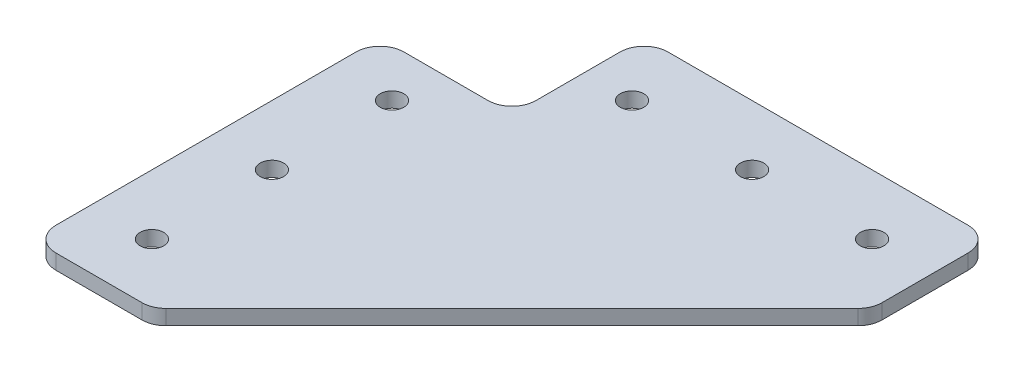
from build123d import *

# Parameters (mm, degrees)
BOSS_EXTRUDE1_DEPTH = 3.175
SKETCH2_R           = 2.4892
CUT_EXTRUDE1_DEPTH  = 144.719172782
SKETCH3_W           = 27.94
SKETCH3_H           = 27.94
CUT_EXTRUDE2_DEPTH  = 144.719172782
FILLET1_R           = 5.08


with BuildPart() as part:
    # Sketch1 → Boss-Extrude1 (new body)
    with BuildSketch(Plane(origin=(0, 0, 0), x_dir=(1, 0, 0), z_dir=(0, 1, 0))):
        Polygon((0, 0), (0, 101.6), (101.6, 101.6), (101.6, 76.2), (25.4, 0), align=None)
    extrude(amount=BOSS_EXTRUDE1_DEPTH)

    # Sketch2 → Cut-Extrude1 (cut, through all)
    with BuildSketch(Plane(origin=(0, 3.175, 0), x_dir=(1, 0, 0), z_dir=(0, 1, 0))):
        with Locations((12.7, 88.9)):
            Circle(SKETCH2_R)
        with Locations((38.1, 88.9)):
            Circle(SKETCH2_R)
        with Locations((63.5, 88.9)):
            Circle(SKETCH2_R)
        with Locations((88.9, 88.9)):
            Circle(SKETCH2_R)
        with Locations((12.7, 63.5)):
            Circle(SKETCH2_R)
        with Locations((12.7, 38.1)):
            Circle(SKETCH2_R)
        with Locations((12.7, 12.7)):
            Circle(SKETCH2_R)
    extrude(amount=-CUT_EXTRUDE1_DEPTH, mode=Mode.SUBTRACT)

    # Sketch3 → Cut-Extrude2 (cut, through all)
    with BuildSketch(Plane(origin=(0, 3.175, 0), x_dir=(1, 0, 0), z_dir=(0, 1, 0))):
        with Locations((13.97, 87.63)):
            Rectangle(SKETCH3_W, SKETCH3_H)
    extrude(amount=-CUT_EXTRUDE2_DEPTH, mode=Mode.SUBTRACT)

    # Fillet1
    fillet1_edges = [part.edges().sort_by_distance(p)[0] for p in [
        (0, 1.5875, 0),
        (25.4, 1.5875, 0),
        (101.6, 1.5875, -76.2),
        (101.6, 1.5875, -101.6),
        (27.94, 1.5875, -101.6),
        (0, 1.5875, -73.66),
        (27.94, 1.5875, -73.66),
    ]]
    fillet(fillet1_edges, radius=FILLET1_R)


solid = part.part
